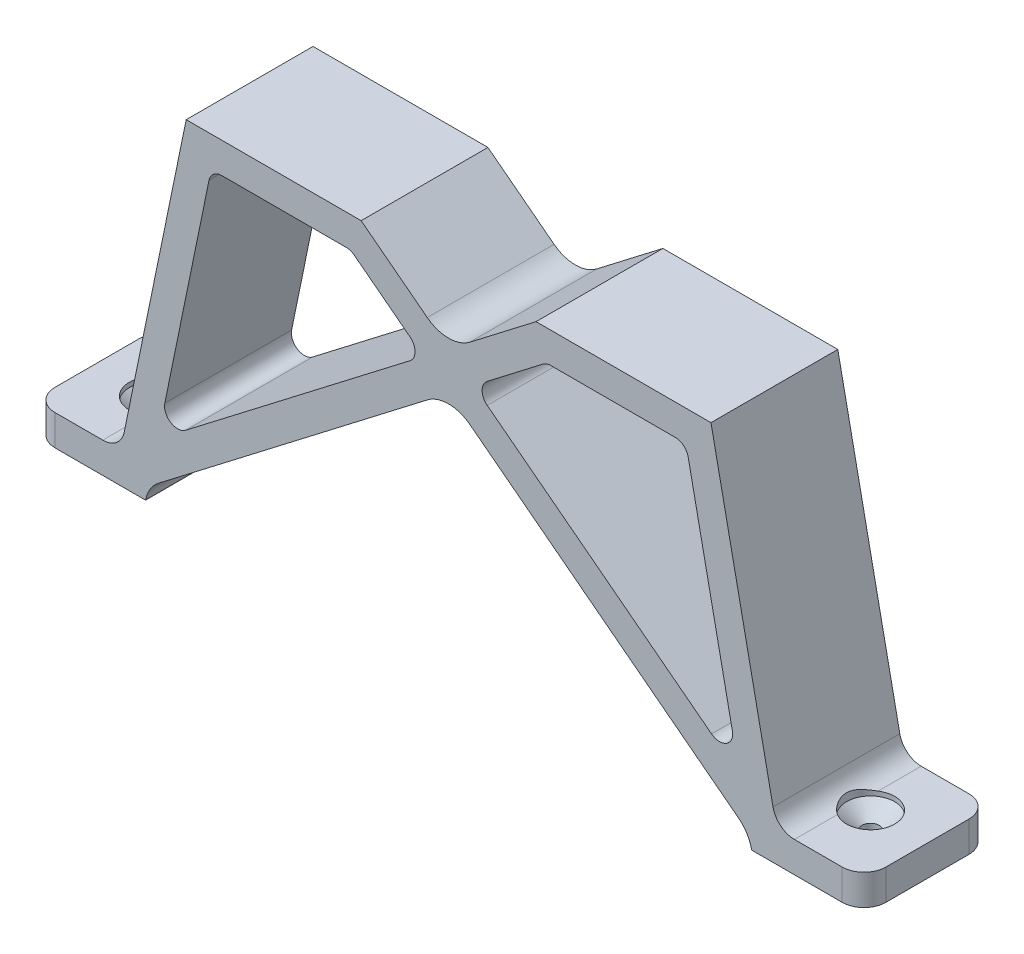
from build123d import *

# Parameters (mm, degrees)
EXTRU_MINCE1_DEPTH      = 14.5
CONG_1_R                = 5
CONG_2_R                = 5
ESQUISSE4_R             = 2
ENL_V_MAT_EXTRU_1_DEPTH = 3
ESQUISSE5_R             = 5.5
ENL_V_MAT_EXTRU_2_DEPTH = 124.143209313
CHANFREIN1_SIZE2        = 3.5
CHANFREIN1_SIZE         = 2.936848709
CONG_3_R                = 8
CONG_4_R                = 3


with BuildPart() as part:
    # Esquisse1 → Extru.-Mince1 (new, symmetric)
    with BuildSketch(Plane.XY):
        Polygon((-95, 0), (-75, 0), (-60, 73), (-20, 73), (75, 0), (70.734848823, -5.550539203), (-22.378866577, 66), (-54.292107606, 66), (-69.292107606, -7), (-95, -7), align=None)
    extrude(amount=EXTRU_MINCE1_DEPTH, both=True)

    # Congé1
    cong_1_edges = [part.edges().sort_by_distance(p)[0] for p in [
        (-95, -3.5, 14.5),
        (-95, -3.5, -14.5),
    ]]
    fillet(cong_1_edges, radius=CONG_1_R)

    # Congé2
    cong_2_edges = [part.edges().sort_by_distance(p)[0] for p in [
        (-75, 0, 0),
    ]]
    fillet(cong_2_edges, radius=CONG_2_R)

    # Esquisse4 → Enlèv. mat.-Extru.1 (cut)
    with BuildSketch(Plane.XZ.offset(7)):
        with Locations((-82, 0)):
            Circle(ESQUISSE4_R)
    extrude(amount=-ENL_V_MAT_EXTRU_1_DEPTH, mode=Mode.SUBTRACT)

    # Esquisse5 → Enlèv. mat.-Extru.2 (cut, through all)
    with BuildSketch(Plane.XZ.offset(4)):
        with Locations((-82, 0)):
            Circle(ESQUISSE5_R)
    extrude(amount=-ENL_V_MAT_EXTRU_2_DEPTH, mode=Mode.SUBTRACT)

    # Chanfrein1
    chanfrein1_edges = [part.edges().sort_by_distance(p)[0] for p in [
        (-87.5, -4, 0),
    ]]
    chanfrein1_side = [part.faces().sort_by_distance(p)[0] for p in [
        (-87.5, -3.941263026, 0),
    ]]
    chamfer(chanfrein1_edges, length=CHANFREIN1_SIZE - 0.0001, length2=CHANFREIN1_SIZE2 - 0.0001, reference=chanfrein1_side[0])  # a hair under: the kernel refuses the full size

    # Symétrie1: part across plane


with BuildPart() as part_1:
    add(part.part)
    add(part.part.mirror(Plane(origin=(0, 0, 0), x_dir=(0, 0, 1), z_dir=(1, 0, 0))))

    # Congé3
    cong_3_edges = [part_1.edges().sort_by_distance(p)[0] for p in [
        (0, 48.803607788, 0),
        (-68.667915266, -3.962263942, 0),
        (0, 57.631578947, 0),
        (68.667915266, -3.962263942, 0),
    ]]
    fillet(cong_3_edges, radius=CONG_3_R)

    # Congé4
    cong_4_edges = [part_1.edges().sort_by_distance(p)[0] for p in [
        (-22.378866577, 66, 0),
        (-54.292107606, 66, 0),
        (5.744227809, 53.217593368, 0),
        (-5.744227809, 53.217593368, 0),
        (66.513829837, 6.520951809, 0),
        (-66.513829837, 6.520951809, 0),
        (54.292107606, 66, 0),
        (22.378866577, 66, 0),
    ]]
    fillet(cong_4_edges, radius=CONG_4_R)


solid = part_1.part
